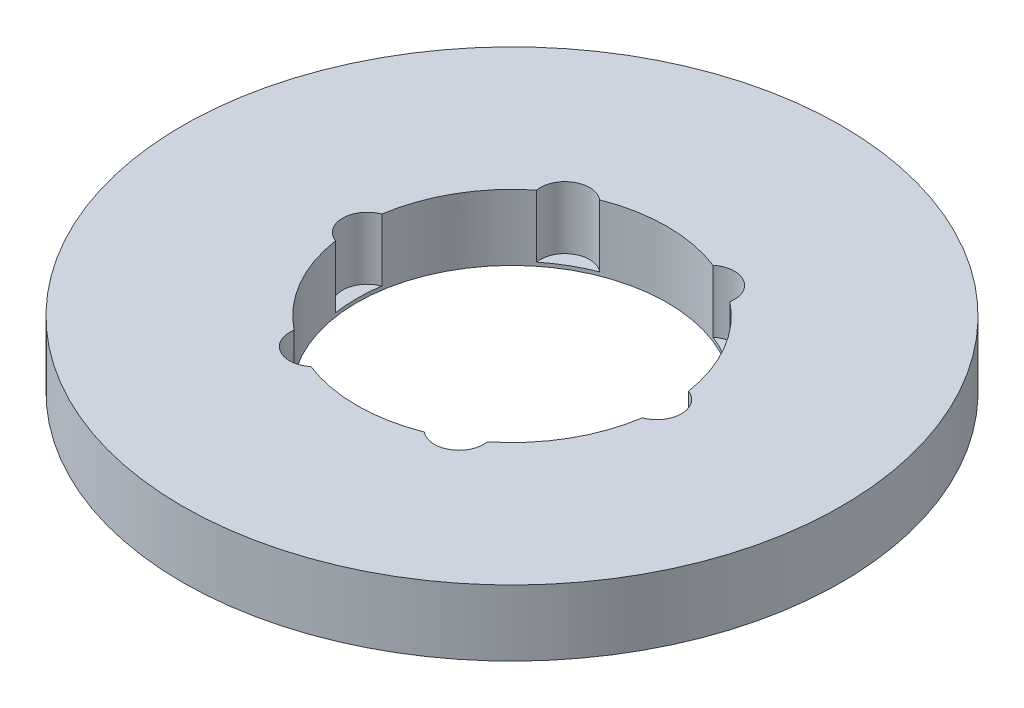
from build123d import *

# Parameters (mm, degrees)
SKETCH1_R           = 85
BOSS_EXTRUDE1_DEPTH = 17
SKETCH2_R           = 40
CUT_EXTRUDE1_DEPTH  = 122.404283285
SKETCH3_R           = 6.354629686
CUT_EXTRUDE2_DEPTH  = 16.080423811
CIRPATTERN1_COUNT   = 6


with BuildPart() as part:
    # Sketch1 → Boss-Extrude1 (new body)
    with BuildSketch(Plane(origin=(0, 0, 0), x_dir=(1, 0, 0), z_dir=(0, 1, 0))):
        Circle(SKETCH1_R)
    extrude(amount=BOSS_EXTRUDE1_DEPTH)

    # Sketch2 → Cut-Extrude1 (cut, through all)
    with BuildSketch(Plane(origin=(0, 0, 0), x_dir=(1, 0, 0), z_dir=(0, 1, 0))):
        Circle(SKETCH2_R)
    extrude(amount=CUT_EXTRUDE1_DEPTH, mode=Mode.SUBTRACT)

    # Sketch3 → Cut-Extrude2 (cut)
    with BuildSketch(Plane(origin=(0, 17, 0), x_dir=(1, 0, 0), z_dir=(0, 1, 0))):
        with Locations((-37.348653681, 0)):
            Circle(SKETCH3_R)
    cut_extrude2 = extrude(amount=-CUT_EXTRUDE2_DEPTH, mode=Mode.SUBTRACT)

    # CirPattern1: Cut-Extrude2 ×6 about axis
    cirpattern1_axis = Axis((0, 0, 0), (0, 1, 0))
    for i in range(1, CIRPATTERN1_COUNT):
        add(cut_extrude2.rotate(cirpattern1_axis, i * 360 / CIRPATTERN1_COUNT), mode=Mode.SUBTRACT)


solid = part.part
